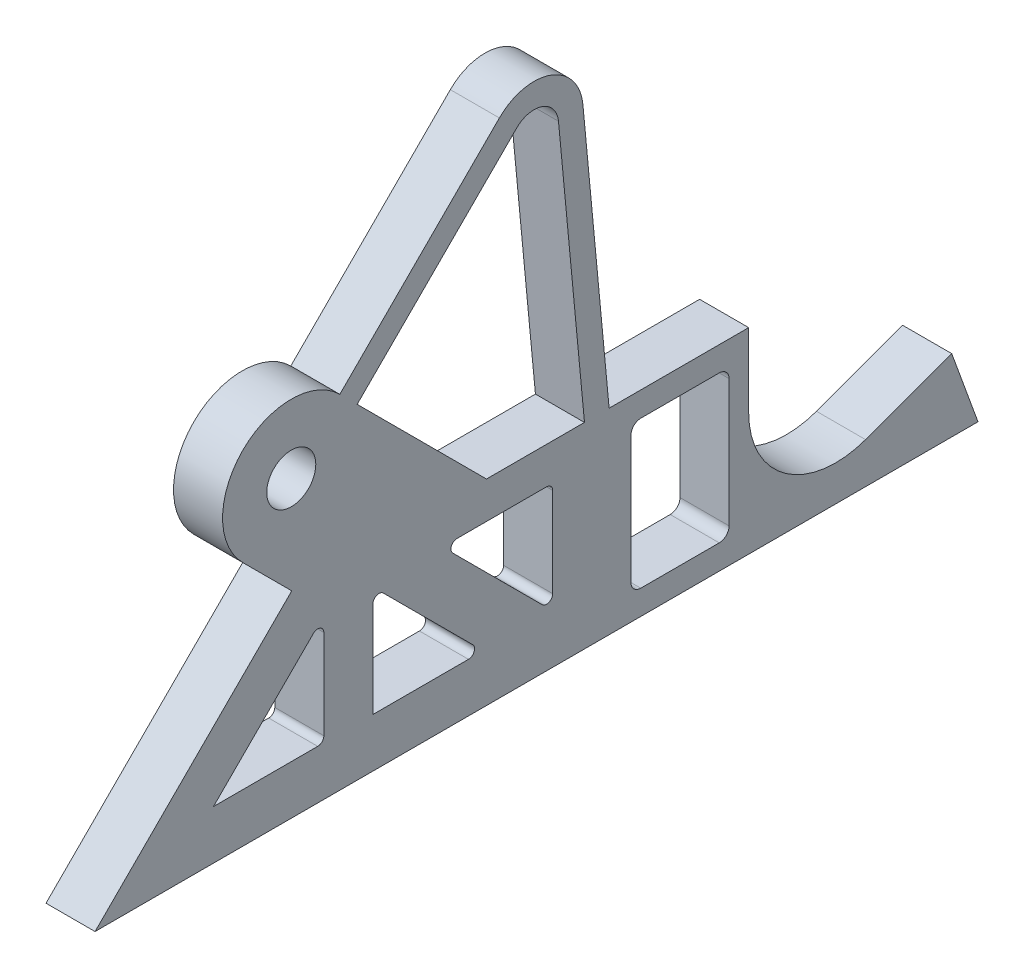
from build123d import *

# Parameters (mm, degrees)
SKETCH1_R           = 6.35
BOSS_EXTRUDE1_DEPTH = 12.7
SKETCH2_W           = 25.4
SKETCH2_H           = 38.1
CUT_EXTRUDE1_DEPTH  = 177.432884383
FILLET1_R           = 2.54
CUT_EXTRUDE2_REACH  = 178.433
FILLET2_R           = 1.5875


with BuildPart() as part:
    # Sketch1 → Boss-Extrude1 (new body)
    with BuildSketch(Plane(origin=(0, 0, 0), x_dir=(0, 0, -1), z_dir=(1, 0, 0))):
        with BuildLine():
            Line((-114.3, 0), (114.3, 0))
            Line((114.3, 0), (107.497444197, 18.689868463))
            Line((107.497444197, 18.689868463), (85.179989081, 10.566979096))
            ThreePointArc((85.179989081, 10.566979096), (64.540153184, 13.284265042), (54.9275, 31.75))
            Line((54.9275, 31.75), (54.9275, 50.8))
            Line((54.9275, 50.8), (18.794717139, 50.8))
            Line((18.794717139, 50.8), (12.004917004, 122.301868615))
            ThreePointArc((12.004917004, 122.301868615), (3.661206708, 133.0513869), (-9.618463274, 130.081536726))
            Line((-9.618463274, 130.081536726), (-50.927641431, 88.772358569))
            ThreePointArc((-50.927641431, 88.772358569), (-76.072358569, 88.772358569), (-76.072358569, 63.627641431))
            Line((-76.072358569, 63.627641431), (-63.372358569, 50.927641431))
            Line((-63.372358569, 50.927641431), (-114.3, 0))
        make_face()
        with BuildLine():
            Line((-12.955282861, 50.8), (-46.43751337, 84.282230509))
            Line((-46.43751337, 84.282230509), (-5.128335213, 125.591408666))
            ThreePointArc((-5.128335213, 125.591408666), (1.511499778, 127.076333753), (5.683354926, 121.70157461))
            Line((5.683354926, 121.70157461), (12.416151287, 50.8))
            Line((12.416151287, 50.8), (-12.955282861, 50.8))
        make_face(mode=Mode.SUBTRACT)
        with Locations((-63.5, 76.2)):
            Circle(SKETCH1_R, mode=Mode.SUBTRACT)
    extrude(amount=BOSS_EXTRUDE1_DEPTH)

    # Sketch2 → Cut-Extrude1 (cut, through all)
    with BuildSketch(Plane(origin=(12.7, 0, 0), x_dir=(0, 0, -1), z_dir=(1, 0, 0))):
        with Locations((37.1475, 25.4)):
            Rectangle(SKETCH2_W, SKETCH2_H)
    extrude(amount=-CUT_EXTRUDE1_DEPTH, mode=Mode.SUBTRACT)

    # Fillet1
    fillet1_edges = [part.edges().sort_by_distance(p)[0] for p in [
        (6.35, 6.35, -24.4475),
        (6.35, 6.35, -49.8475),
        (6.35, 44.45, -49.8475),
        (6.35, 44.45, -24.4475),
    ]]
    fillet(fillet1_edges, radius=FILLET1_R)

    # Sketch3 → Cut-Extrude2 (cut, up to next)
    with BuildSketch(Plane(origin=(12.7, 0, 0), x_dir=(0, 0, -1), z_dir=(1, 0, 0)), mode=Mode.PRIVATE) as cut_extrude2_sk1:
        Polygon((-83.639487758, 12.7), (-55.064487758, 41.275), (-55.064487758, 12.7), align=None)
    cut_extrude2_tool1 = extrude(cut_extrude2_sk1.sketch, amount=-CUT_EXTRUDE2_REACH, mode=Mode.PRIVATE) & part.part
    # Sketch3 → Cut-Extrude2 (cut, up to next)
    with BuildSketch(Plane(origin=(12.7, 0, 0), x_dir=(0, 0, -1), z_dir=(1, 0, 0)), mode=Mode.PRIVATE) as cut_extrude2_sk2:
        Polygon((-42.364487758, 41.275), (-42.364487758, 12.7), (-13.789487758, 12.7), align=None)
    cut_extrude2_tool2 = extrude(cut_extrude2_sk2.sketch, amount=-CUT_EXTRUDE2_REACH, mode=Mode.PRIVATE) & part.part
    # Sketch3 → Cut-Extrude2 (cut, up to next)
    with BuildSketch(Plane(origin=(12.7, 0, 0), x_dir=(0, 0, -1), z_dir=(1, 0, 0)), mode=Mode.PRIVATE) as cut_extrude2_sk3:
        Polygon((-24.403975516, 41.275), (4.171024484, 41.275), (4.171024484, 12.7), align=None)
    cut_extrude2_tool3 = extrude(cut_extrude2_sk3.sketch, amount=-CUT_EXTRUDE2_REACH, mode=Mode.PRIVATE) & part.part
    add(cut_extrude2_tool1.solids().sort_by_distance((12.7, 22.225, 64.589488))[0], mode=Mode.SUBTRACT)
    add(cut_extrude2_tool2.solids().sort_by_distance((12.7, 22.225, 32.839488))[0], mode=Mode.SUBTRACT)
    add(cut_extrude2_tool3.solids().sort_by_distance((12.7, 31.75, 5.353976))[0], mode=Mode.SUBTRACT)

    # Fillet2
    fillet2_edges = [part.edges().sort_by_distance(p)[0] for p in [
        (6.35, 12.7, 55.064487758),
        (6.35, 12.7, 13.789487758),
        (6.35, 12.7, -4.171024484),
        (6.35, 41.275, -4.171024484),
        (6.35, 41.275, 24.403975516),
        (6.35, 41.275, 42.364487758),
        (6.35, 41.275, 55.064487758),
    ]]
    fillet(fillet2_edges, radius=FILLET2_R)


solid = part.part
